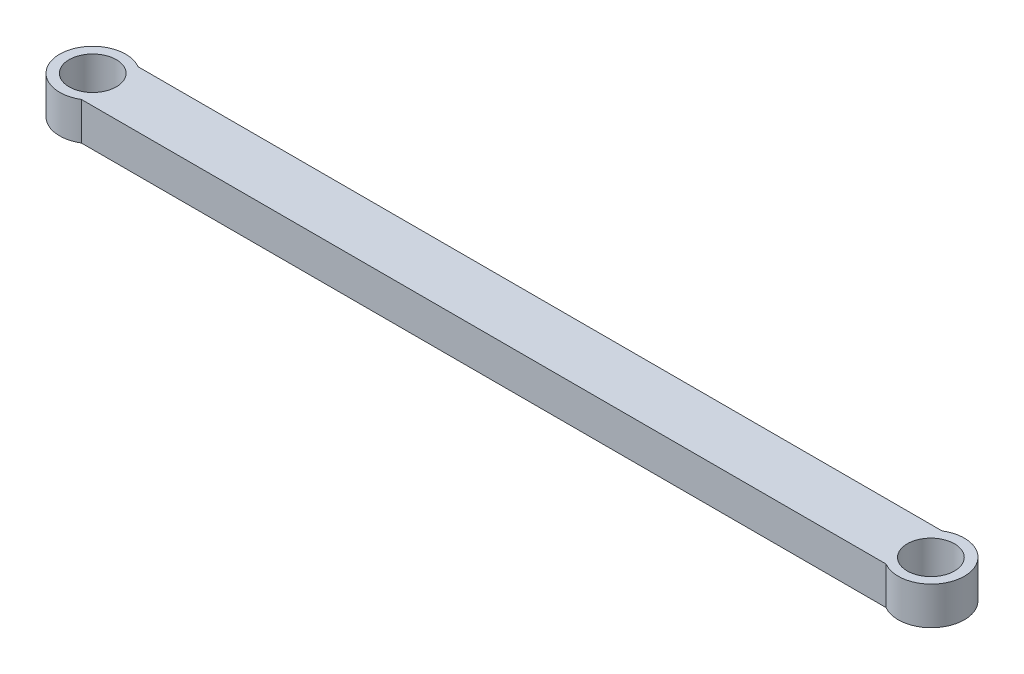
from build123d import *

# Parameters (mm, degrees)
SKETCH2_R           = 1.25
BOSS_EXTRUDE1_DEPTH = 2


with BuildPart() as part:
    # Sketch2 → Boss-Extrude1 (new body)
    with BuildSketch(Plane(origin=(0, 0, 0), x_dir=(1, 0, 0), z_dir=(0, 1, 0))):
        with BuildLine():
            ThreePointArc((0.901387819, 1.5), (-1.75, 0), (0.901387819, -1.5))
            Line((0.901387819, -1.5), (43.499845541, -1.5))
            ThreePointArc((43.499845541, -1.5), (46.133386411, 0.03092307), (43.464851994, 1.5))
            Line((43.464851994, 1.5), (0.901387819, 1.5))
        make_face()
        Circle(SKETCH2_R, mode=Mode.SUBTRACT)
        with Locations((44.383505452, -0.010511556)):
            Circle(SKETCH2_R, mode=Mode.SUBTRACT)
    extrude(amount=BOSS_EXTRUDE1_DEPTH)


solid = part.part
